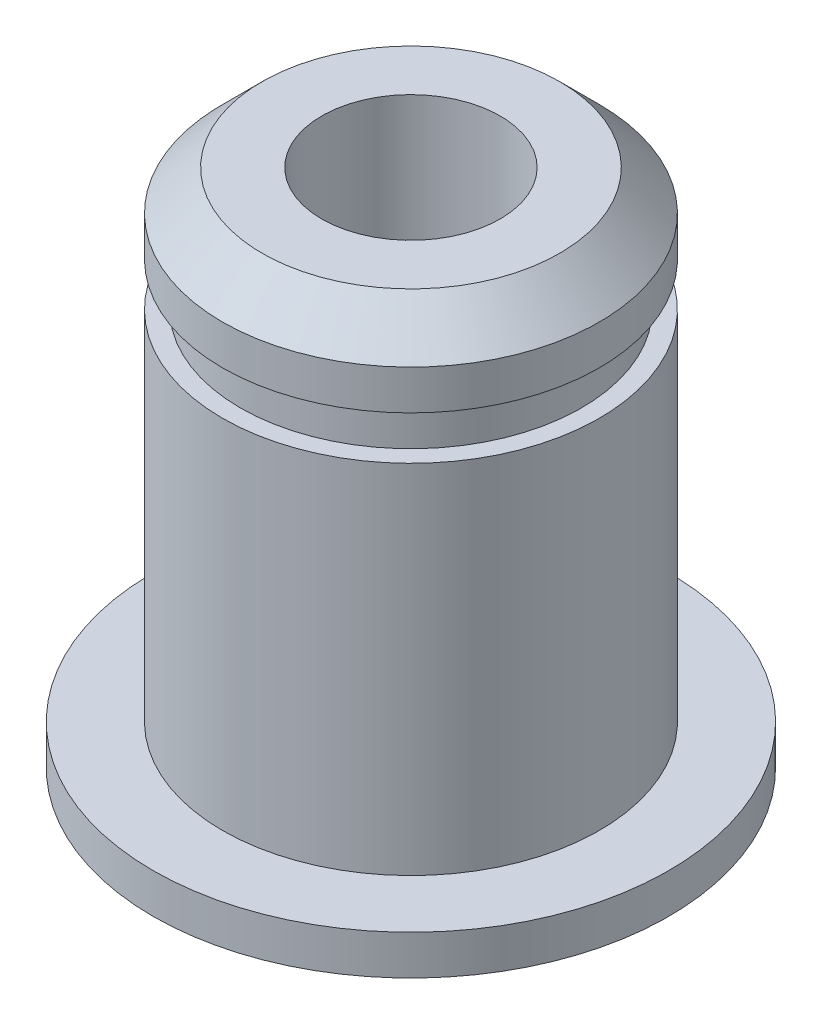
from build123d import *

# Parameters (mm, degrees)
CHAMFER1_SIZE = 1


with BuildPart() as part:
    # Sketch1 → Revolve1 (revolve)
    with BuildSketch(Plane.XY):
        Polygon((2.25, 13.1), (2.25, 0), (6.5, 0), (6.5, 1), (4.75, 1), (4.75, 10), (4.3, 10), (4.3, 11.1), (4.75, 11.1), (4.75, 13.1), align=None)
    revolve(axis=Axis((0, 13.1, 0), (0, -1, 0)))

    # Chamfer1
    chamfer1_edges = [part.edges().sort_by_distance(p)[0] for p in [
        (-4.75, 13.1, 0),
    ]]
    chamfer(chamfer1_edges, length=CHAMFER1_SIZE)


solid = part.part
